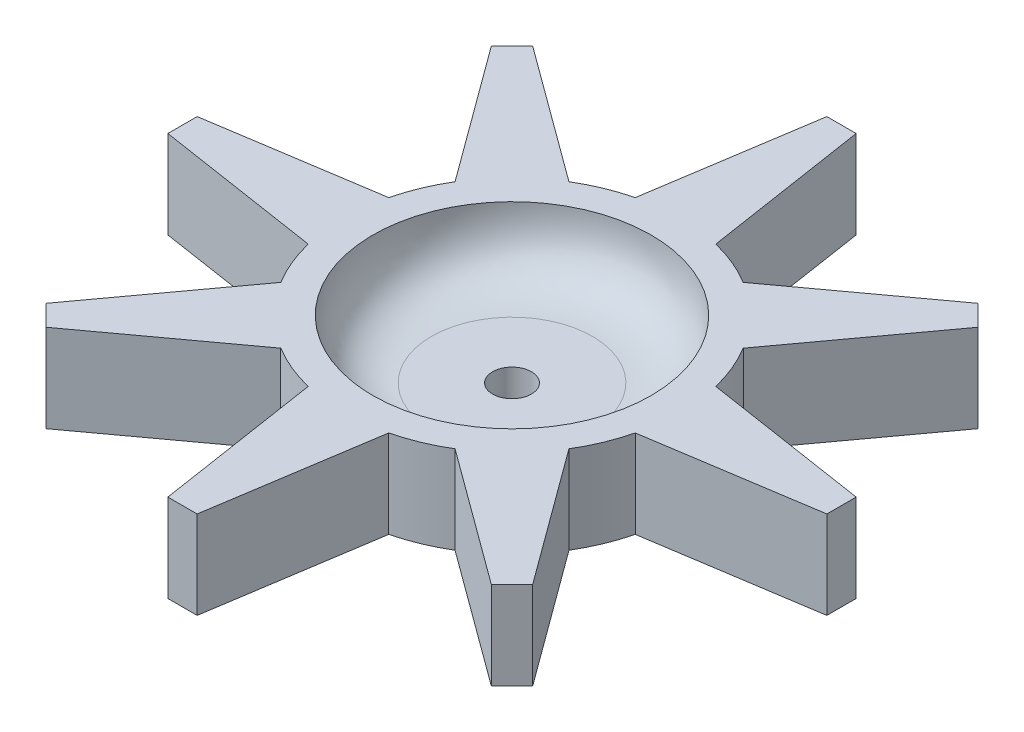
from build123d import *

# Parameters (mm, degrees)
SKETCH1_R           = 11.5
SKETCH1_R_2         = 9.5
BOSS_EXTRUDE2_DEPTH = 6
SKETCH1_6_R         = 11.5
SKETCH1_6_R_2       = 1.325
BOSS_EXTRUDE3_DEPTH = 2
FILLET4_SIZE        = 4


with BuildPart() as part:
    # Sketch1 → Boss-Extrude2 (new body)
    # profile 1 of 9: a face of its own
    with BuildSketch(Plane(origin=(0, 0, 0), x_dir=(1, 0, 0), z_dir=(0, 1, 0))):
        with BuildLine():
            ThreePointArc((-11.166355717, -2.75), (-11.5, 0), (-11.166355717, 2.75))
            Line((-11.166355717, 2.75), (-22.5, 1))
            Line((-22.5, 1), (-22.5, -1))
            Line((-22.5, -1), (-11.166355717, -2.75))
        make_face()
    # profile 2 of 9: a face of its own
    with BuildSketch(Plane(origin=(0, 0, 0), x_dir=(1, 0, 0), z_dir=(0, 1, 0))):
        with BuildLine():
            Line((-15.202795796, -16.617009358), (-5.9512622, -9.840349497))
            ThreePointArc((-5.9512622, -9.840349497), (-8.131727984, -8.131727984), (-9.840349497, -5.9512622))
            Line((-9.840349497, -5.9512622), (-16.617009358, -15.202795796))
            Line((-16.617009358, -15.202795796), (-15.202795796, -16.617009358))
        make_face()
    # profile 3 of 9: a face of its own
    with BuildSketch(Plane(origin=(0, 0, 0), x_dir=(1, 0, 0), z_dir=(0, 1, 0))):
        with BuildLine():
            ThreePointArc((-9.840349497, 5.9512622), (-8.131727984, 8.131727984), (-5.9512622, 9.840349497))
            Line((-5.9512622, 9.840349497), (-15.202795796, 16.617009358))
            Line((-15.202795796, 16.617009358), (-16.617009358, 15.202795796))
            Line((-16.617009358, 15.202795796), (-9.840349497, 5.9512622))
        make_face()
    # profile 4 of 9: a face of its own
    with BuildSketch(Plane(origin=(0, 0, 0), x_dir=(1, 0, 0), z_dir=(0, 1, 0))):
        with BuildLine():
            ThreePointArc((-2.75, 11.166355717), (0, 11.5), (2.75, 11.166355717))
            Line((2.75, 11.166355717), (1, 22.5))
            Line((1, 22.5), (-1, 22.5))
            Line((-1, 22.5), (-2.75, 11.166355717))
        make_face()
    # profile 5 of 9: a face of its own
    with BuildSketch(Plane(origin=(0, 0, 0), x_dir=(1, 0, 0), z_dir=(0, 1, 0))):
        with BuildLine():
            ThreePointArc((5.9512622, 9.840349497), (8.131727984, 8.131727984), (9.840349497, 5.9512622))
            Line((9.840349497, 5.9512622), (16.617009358, 15.202795796))
            Line((16.617009358, 15.202795796), (15.202795796, 16.617009358))
            Line((15.202795796, 16.617009358), (5.9512622, 9.840349497))
        make_face()
    # profile 6 of 9: a face of its own
    with BuildSketch(Plane(origin=(0, 0, 0), x_dir=(1, 0, 0), z_dir=(0, 1, 0))):
        with BuildLine():
            Line((22.5, 1), (11.166355717, 2.75))
            ThreePointArc((11.166355717, 2.75), (11.416284219, 1.385082895), (11.5, 0))
            ThreePointArc((11.5, 0), (11.416284219, -1.385082895), (11.166355717, -2.75))
            Line((11.166355717, -2.75), (22.5, -1))
            Line((22.5, -1), (22.5, 1))
        make_face()
    # profile 7 of 9: a face of its own
    with BuildSketch(Plane(origin=(0, 0, 0), x_dir=(1, 0, 0), z_dir=(0, 1, 0))):
        with BuildLine():
            Line((1, -22.5), (2.75, -11.166355717))
            ThreePointArc((2.75, -11.166355717), (0, -11.5), (-2.75, -11.166355717))
            Line((-2.75, -11.166355717), (-1, -22.5))
            Line((-1, -22.5), (1, -22.5))
        make_face()
    # profile 8 of 9: a face of its own
    with BuildSketch(Plane(origin=(0, 0, 0), x_dir=(1, 0, 0), z_dir=(0, 1, 0))):
        with BuildLine():
            Line((16.617009358, -15.202795796), (9.840349497, -5.9512622))
            ThreePointArc((9.840349497, -5.9512622), (8.131727984, -8.131727984), (5.9512622, -9.840349497))
            Line((5.9512622, -9.840349497), (15.202795796, -16.617009358))
            Line((15.202795796, -16.617009358), (16.617009358, -15.202795796))
        make_face()
    # profile 9 of 9: a face of its own
    with BuildSketch(Plane(origin=(0, 0, 0), x_dir=(1, 0, 0), z_dir=(0, 1, 0))):
        Circle(SKETCH1_R)
        with Locations(Location((0, 0, 0), (0, 0, 270))):
            Circle(SKETCH1_R_2, mode=Mode.SUBTRACT)
    extrude(amount=BOSS_EXTRUDE2_DEPTH)

    # Sketch1<6> → Boss-Extrude3 (add)
    with BuildSketch(Plane(origin=(0, 0, 0), x_dir=(1, 0, 0), z_dir=(0, 1, 0))):
        Circle(SKETCH1_6_R)
        with Locations(Location((0, 0, 0), (0, 0, 270))):
            Circle(SKETCH1_6_R_2, mode=Mode.SUBTRACT)
    extrude(amount=BOSS_EXTRUDE3_DEPTH)

    # Fillet4
    # a fillet whose section is not a circle: 4 mm, written as the material it adds along each edge
    with BuildSketch(Plane(origin=(0, 2, 0), x_dir=(0, 0, 1), z_dir=(1, 0, 0))) as fillet4_piece_1:
        with BuildLine():
            Bezier((9.5 - FILLET4_SIZE, 0), (9.5, 0), (9.5, -FILLET4_SIZE), weights=[1, 1, 1])
            Line((9.5, -FILLET4_SIZE), (9.5, 0))
            Line((9.5, 0), (9.5 - FILLET4_SIZE, 0))
        make_face()
    revolve(axis=Axis((0, 2, 0), (0, -1, 0)))


solid = part.part
